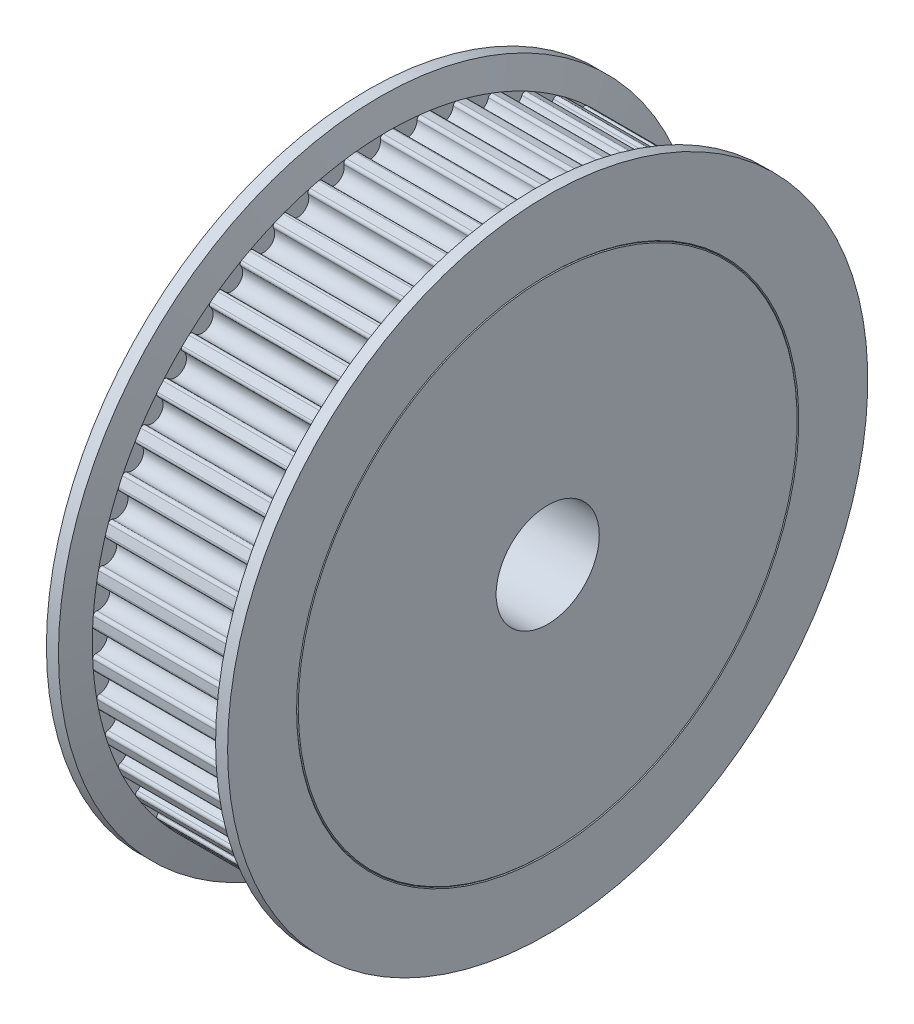
from build123d import *

# Parameters (mm, degrees)
SKETCH_2_R      = 2.58
BORE_DEPTH      = 28.241599687
F_20TOOTH_START = -1
SKETCH_3_R      = 0.55
F_20TOOTH_DEPTH = 7
FILLET_1_R      = 0.15


with BuildPart() as part:
    # Эскиз1 → Body (revolve)
    with BuildSketch(Plane.XY):
        Polygon((0, 7.282429663), (0, 0), (15, 0), (15, 12.480518109), (14.958790953, 12.521727156), (15, 12.562936203), (15, 16.014212221), (14.398179889, 16.014212221), (14, 14.78), (7, 14.78), (6.601820111, 16.079563948), (6, 16.079563948), (6, 12.562936203), (6.041209047, 12.521727156), (6, 12.480518109), (6, 7.5), (0.2, 7.5), align=None)
    revolve(axis=Axis((0, 0, 0), (1, 0, 0)))

    # Эскиз2 → Bore (cut, through all)
    with BuildSketch(Plane(origin=(15, 0, 0), x_dir=(0, 0, -1), z_dir=(1, 0, 0))):
        Circle(SKETCH_2_R)
    extrude(amount=-BORE_DEPTH, mode=Mode.SUBTRACT)

    # Эскиз3 → 20tooth (cut)
    with BuildSketch(Plane.ZY.offset(-6).offset(F_20TOOTH_START)):
        with Locations((14.457356915, -1.826388913)):
            Circle(SKETCH_3_R)
        with Locations((-11.789208871, -8.565361616)):
            Circle(SKETCH_3_R)
        with Locations((14.114449109, -3.623974582)):
            Circle(SKETCH_3_R)
        with Locations((13.548948009, -5.364408007)):
            Circle(SKETCH_3_R)
        with Locations((12.769771906, -7.020241513)):
            Circle(SKETCH_3_R)
        with Locations((11.789208871, -8.565361616)):
            Circle(SKETCH_3_R)
        with Locations((14.572263566, 0)):
            Circle(SKETCH_3_R)
        with Locations((10.62272297, -9.975400851)):
            Circle(SKETCH_3_R)
        with Locations((9.288710382, -11.228122054)):
            Circle(SKETCH_3_R)
        with Locations((7.808209282, -12.303769066)):
            Circle(SKETCH_3_R)
        with Locations((6.204568057, -13.18537829)):
            Circle(SKETCH_3_R)
        with Locations((4.503077088, -13.859046221)):
            Circle(SKETCH_3_R)
        with Locations((2.730569903, -14.314148715)):
            Circle(SKETCH_3_R)
        with Locations((0.915, -14.543508532)):
            Circle(SKETCH_3_R)
        with Locations((-0.915, -14.543508532)):
            Circle(SKETCH_3_R)
        with Locations((-12.769771906, -7.020241513)):
            Circle(SKETCH_3_R)
        with Locations((-13.548948009, -5.364408007)):
            Circle(SKETCH_3_R)
        with Locations((-2.730569903, -14.314148715)):
            Circle(SKETCH_3_R)
        with Locations((-4.503077088, -13.859046221)):
            Circle(SKETCH_3_R)
        with Locations((-6.204568057, -13.18537829)):
            Circle(SKETCH_3_R)
        with Locations((-7.808209282, -12.303769066)):
            Circle(SKETCH_3_R)
        with Locations((-9.288710382, -11.228122054)):
            Circle(SKETCH_3_R)
        with Locations((-10.62272297, -9.975400851)):
            Circle(SKETCH_3_R)
        with Locations((-14.114449109, -3.623974582)):
            Circle(SKETCH_3_R)
        with Locations((-14.457356915, -1.826388913)):
            Circle(SKETCH_3_R)
        with Locations((-14.572263566, 0)):
            Circle(SKETCH_3_R)
        with Locations((-14.457356915, 1.826388913)):
            Circle(SKETCH_3_R)
        with Locations((-14.114449109, 3.623974582)):
            Circle(SKETCH_3_R)
        with Locations((-13.548948009, 5.364408007)):
            Circle(SKETCH_3_R)
        with Locations((-12.769771906, 7.020241513)):
            Circle(SKETCH_3_R)
        with Locations((-11.789208871, 8.565361616)):
            Circle(SKETCH_3_R)
        with Locations((-10.62272297, 9.975400851)):
            Circle(SKETCH_3_R)
        with Locations((-9.288710382, 11.228122054)):
            Circle(SKETCH_3_R)
        with Locations((-7.808209282, 12.303769066)):
            Circle(SKETCH_3_R)
        with Locations((-6.204568057, 13.18537829)):
            Circle(SKETCH_3_R)
        with Locations((-4.503077088, 13.859046221)):
            Circle(SKETCH_3_R)
        with Locations((-2.730569903, 14.314148715)):
            Circle(SKETCH_3_R)
        with Locations((-0.915, 14.543508532)):
            Circle(SKETCH_3_R)
        with Locations((0.915, 14.543508532)):
            Circle(SKETCH_3_R)
        with Locations((2.730569903, 14.314148715)):
            Circle(SKETCH_3_R)
        with Locations((4.503077088, 13.859046221)):
            Circle(SKETCH_3_R)
        with Locations((6.204568057, 13.18537829)):
            Circle(SKETCH_3_R)
        with Locations((7.808209282, 12.303769066)):
            Circle(SKETCH_3_R)
        with Locations((9.288710382, 11.228122054)):
            Circle(SKETCH_3_R)
        with Locations((10.62272297, 9.975400851)):
            Circle(SKETCH_3_R)
        with Locations((11.789208871, 8.565361616)):
            Circle(SKETCH_3_R)
        with Locations((12.769771906, 7.020241513)):
            Circle(SKETCH_3_R)
        with Locations((13.548948009, 5.364408007)):
            Circle(SKETCH_3_R)
        with Locations((14.114449109, 3.623974582)):
            Circle(SKETCH_3_R)
        with Locations((14.457356915, 1.826388913)):
            Circle(SKETCH_3_R)
    extrude(amount=-F_20TOOTH_DEPTH, mode=Mode.SUBTRACT)

    # Скругление1
    fillet_1_edges = [part.edges().sort_by_distance(p)[0] for p in [
        (10.5, 0.512799685, 14.771101397),
        (10.5, -0.512799685, 14.771101397),
        (10.5, -2.360066008, 14.590356008),
        (10.5, -1.342553795, 14.718897693),
        (10.5, -4.170112679, 14.179511989),
        (10.5, -3.1767344, 14.43456818),
        (10.5, -5.914394183, 13.545048595),
        (10.5, -4.960816006, 13.922596904),
        (10.5, -7.565402158, 12.696971694),
        (10.5, -6.666662579, 13.191057958),
        (10.5, -9.097099221, 11.648655964),
        (10.5, -8.267371902, 12.251488148),
        (10.5, -10.485329595, 10.416633971),
        (10.5, -9.73769983, 11.118705051),
        (10.5, -11.708200058, 9.020335437),
        (10.5, -11.054458416, 9.810573334),
        (10.5, -12.746425212, 7.481780826),
        (10.5, -12.196881588, 8.347723014),
        (10.5, -13.583631625, 5.825234061),
        (10.5, -13.146952652, 6.753224116),
        (10.5, -14.206616054, 4.076819876),
        (10.5, -13.889688419, 5.052222839),
        (10.5, -14.605553661, 2.264111805),
        (10.5, -14.413375503, 3.27154499),
        (10.5, -14.774152961, 0.415697339),
        (10.5, -14.709755044, 1.439272923),
        (10.5, -14.709755044, -1.439272923),
        (10.5, -14.774152961, -0.415697339),
        (10.5, -14.413375503, -3.27154499),
        (10.5, -14.605553661, -2.264111805),
        (10.5, -14.206616054, -4.076819876),
        (10.5, -13.583631625, -5.825234061),
        (10.5, -12.746425212, -7.481780826),
        (10.5, -11.708200058, -9.020335437),
        (10.5, -10.485329595, -10.416633971),
        (10.5, -9.73769983, -11.118705051),
        (10.5, -11.054458416, -9.810573334),
        (10.5, -13.889688419, -5.052222839),
        (10.5, -13.146952652, -6.753224116),
        (10.5, -12.196881588, -8.347723014),
        (10.5, -4.170112679, -14.179511989),
        (10.5, -4.960816006, -13.922596904),
        (10.5, -5.914394183, -13.545048595),
        (10.5, -6.666662579, -13.191057958),
        (10.5, -7.565402158, -12.696971694),
        (10.5, -8.267371902, -12.251488148),
        (10.5, -9.097099221, -11.648655964),
        (10.5, -3.1767344, -14.43456818),
        (10.5, -2.360066008, -14.590356008),
        (10.5, -1.342553795, -14.718897693),
        (10.5, -0.512799685, -14.771101397),
        (10.5, 0.512799685, -14.771101397),
        (10.5, 1.342553795, -14.718897693),
        (10.5, 2.360066008, -14.590356008),
        (10.5, 3.1767344, -14.43456818),
        (10.5, 4.170112679, -14.179511989),
        (10.5, 4.960816006, -13.922596904),
        (10.5, 5.914394183, -13.545048595),
        (10.5, 6.666662579, -13.191057958),
        (10.5, 7.565402158, -12.696971694),
        (10.5, 8.267371902, -12.251488148),
        (10.5, 9.097099221, -11.648655964),
        (10.5, 9.73769983, -11.118705051),
        (10.5, 10.485329595, -10.416633971),
        (10.5, 11.054458416, -9.810573334),
        (10.5, 11.708200058, -9.020335437),
        (10.5, 12.196881588, -8.347723014),
        (10.5, 12.746425212, -7.481780826),
        (10.5, 13.146952652, -6.753224116),
        (10.5, 13.583631625, -5.825234061),
        (10.5, 13.889688419, -5.052222839),
        (10.5, 14.206616054, -4.076819876),
        (10.5, 14.413375503, -3.27154499),
        (10.5, 14.605553661, -2.264111805),
        (10.5, 14.709755044, -1.439272923),
        (10.5, 14.774152961, -0.415697339),
        (10.5, 14.774152961, 0.415697339),
        (10.5, 14.709755044, 1.439272923),
        (10.5, 14.605553661, 2.264111805),
        (10.5, 14.413375503, 3.27154499),
        (10.5, 14.206616054, 4.076819876),
        (10.5, 13.889688419, 5.052222839),
        (10.5, 13.583631625, 5.825234061),
        (10.5, 13.146952652, 6.753224116),
        (10.5, 12.746425212, 7.481780826),
        (10.5, 12.196881588, 8.347723014),
        (10.5, 11.708200058, 9.020335437),
        (10.5, 11.054458416, 9.810573334),
        (10.5, 10.485329595, 10.416633971),
        (10.5, 9.73769983, 11.118705051),
        (10.5, 9.097099221, 11.648655964),
        (10.5, 8.267371902, 12.251488148),
        (10.5, 7.565402158, 12.696971694),
        (10.5, 6.666662579, 13.191057958),
        (10.5, 5.914394183, 13.545048595),
        (10.5, 4.960816006, 13.922596904),
        (10.5, 4.170112679, 14.179511989),
        (10.5, 3.1767344, 14.43456818),
        (10.5, 2.360066008, 14.590356008),
        (10.5, 1.342553795, 14.718897693),
    ]]
    fillet(fillet_1_edges, radius=FILLET_1_R)


solid = part.part
